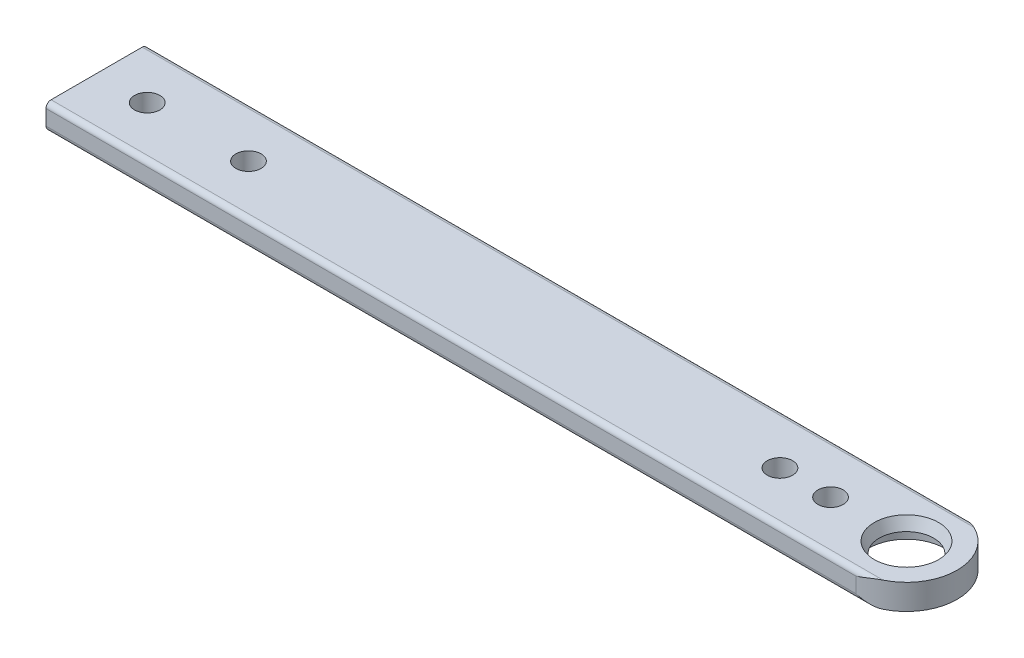
from build123d import *

# Parameters (mm, degrees)
SKETCH1_W           = 215.9
SKETCH1_H           = 25.4
BOSS_EXTRUDE1_DEPTH = 6.35
FILLET1_R           = 1.27
SKETCH2_R           = 3.175
SKETCH2_R_2         = 6.35
CUT_EXTRUDE1_DEPTH  = 109.879819067
SKETCH3_R           = 9.525
CUT_EXTRUDE2_DEPTH  = 3.571875
CUT_EXTRUDE3_DEPTH  = 109.879819067
SKETCH5_R           = 3.175
CUT_EXTRUDE4_DEPTH  = 109.879819183


with BuildPart() as part:
    # Sketch1 → Boss-Extrude1 (new body)
    with BuildSketch(Plane(origin=(0, 0, 0), x_dir=(1, 0, 0), z_dir=(0, 1, 0))):
        Rectangle(SKETCH1_W, SKETCH1_H)
    extrude(amount=BOSS_EXTRUDE1_DEPTH)

    # Fillet1
    fillet1_edges = [part.edges().sort_by_distance(p)[0] for p in [
        (0, 0, -12.7),
        (0, 6.35, -12.7),
        (0, 0, 12.7),
        (0, 6.35, 12.7),
    ]]
    fillet(fillet1_edges, radius=FILLET1_R)

    # Sketch2 → Cut-Extrude1 (cut, through all)
    with BuildSketch(Plane(origin=(0, 6.35, 0), x_dir=(1, 0, 0), z_dir=(0, 1, 0))):
        with Locations((-95.25, 0)):
            Circle(SKETCH2_R)
        with Locations((95.25, 0)):
            Circle(SKETCH2_R_2)
        with Locations((-69.85, 0)):
            Circle(SKETCH2_R)
    extrude(amount=-CUT_EXTRUDE1_DEPTH, mode=Mode.SUBTRACT)

    # Sketch3 → Cut-Extrude2 (cut)
    with BuildSketch(Plane.XZ):
        with Locations((95.25, 0)):
            Circle(SKETCH3_R)
    extrude(amount=-CUT_EXTRUDE2_DEPTH, mode=Mode.SUBTRACT)

    # Sketch4 → Cut-Extrude3 (cut, through all)
    with BuildSketch(Plane.XZ):
        with BuildLine():
            Line((95.250000011, -12.7), (107.95, -12.7))
            Line((107.95, -12.7), (107.95, 0))
            ThreePointArc((107.95, 0), (104.230256125, -8.980256117), (95.250000011, -12.7))
        make_face()
        with BuildLine():
            Line((107.95, 0), (107.95, 12.7))
            Line((107.95, 12.7), (95.249999989, 12.7))
            ThreePointArc((95.249999989, 12.7), (104.230256117, 8.980256125), (107.95, 0))
        make_face()
    extrude(amount=-CUT_EXTRUDE3_DEPTH, mode=Mode.SUBTRACT)

    # Sketch5 → Cut-Extrude4 (cut, through all)
    with BuildSketch(Plane.XZ):
        with Locations((76.2, 0)):
            Circle(SKETCH5_R)
        with Locations((63.5, 0)):
            Circle(SKETCH5_R)
    extrude(amount=-CUT_EXTRUDE4_DEPTH, mode=Mode.SUBTRACT)

    # Sketch8 → Cut-Revolve1 (revolve, cut)
    with BuildSketch(Plane.XY):
        Polygon((103.31821119, 6.35), (101.6, 6.35), (101.6, 3.571875), (102.081310248, 3.571875), align=None)
    revolve(axis=Axis((95.25, 3.571875, 0), (0, 1, 0)), mode=Mode.SUBTRACT)


solid = part.part
